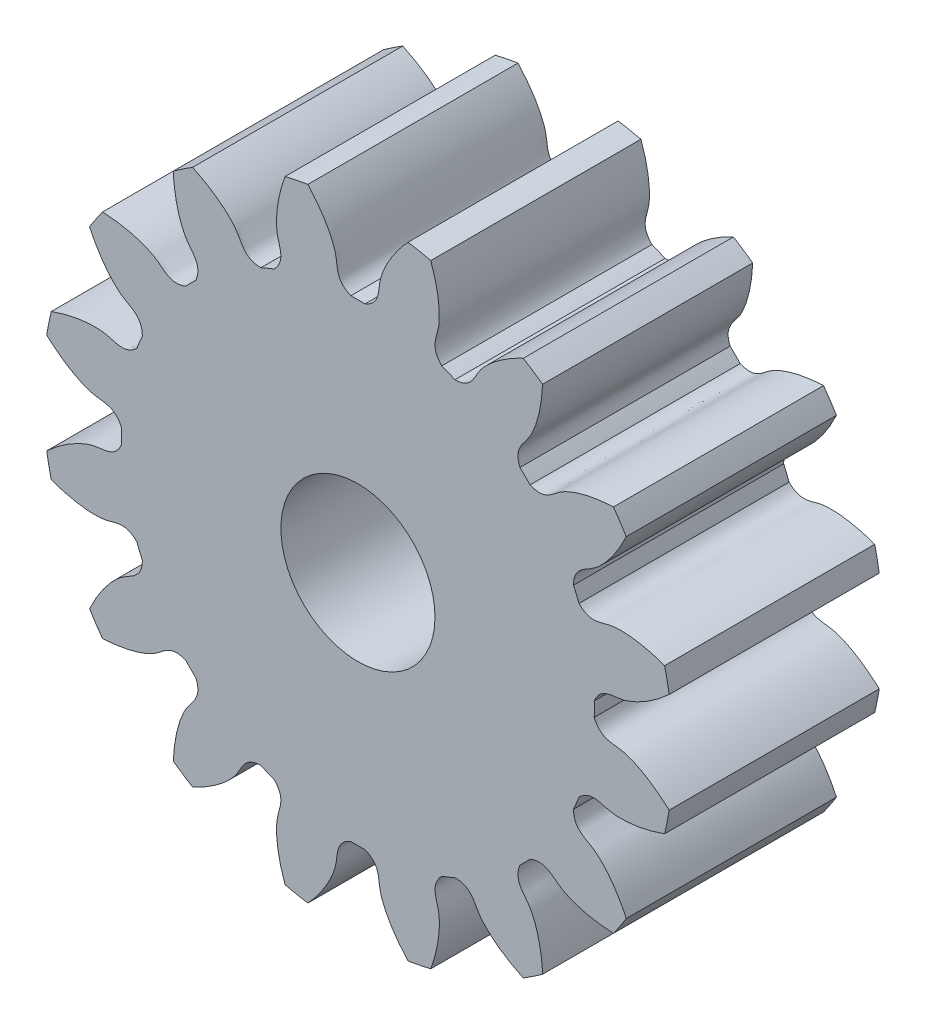
from build123d import *

# Parameters (mm, degrees)
SKETCH_1_R               = 4.5
EXTRUDE_1_DEPTH          = 3
CUT_EXTRUDE_1_DEPTH      = 8.03562364
PATTERN_CIRCULAR_1_COUNT = 16
SKETCH_4_R               = 1.1
CUT_EXTRUDE_2_DEPTH      = 10


with BuildPart() as part:
    # 草图1 → 凸台-拉伸1 (new body)
    with BuildSketch(Plane.XY):
        Circle(SKETCH_1_R)
    extrude(amount=EXTRUDE_1_DEPTH)

    # 草图2 → 切除-拉伸1 (cut, through all)
    with BuildSketch(Plane.XY):
        with BuildLine():
            ThreePointArc((0.101680395, 3.373467963), (0, 3.375), (-0.101680395, 3.373467963))
            add(Edge.make_bspline(
                [(-0.101680395, 3.373467963), (-0.320919735, 3.465061005), (-0.284660598, 3.635349809), (-0.322390644, 3.793404963), (-0.325601394, 3.80577545), (-0.329466049, 3.819526781), (-0.334039479, 3.834637453), (-0.339377888, 3.851083952), (-0.345536205, 3.868841182), (-0.352568839, 3.887882349), (-0.360529384, 3.908179024), (-0.369470654, 3.92970115), (-0.379444617, 3.952417062), (-0.390502356, 3.976293514), (-0.402694025, 4.001295699), (-0.416068812, 4.02738727), (-0.430674889, 4.054530373), (-0.446559381, 4.082685666), (-0.463768319, 4.111812348), (-0.482346604, 4.141868189), (-0.502337967, 4.172809557), (-0.523784931, 4.20459145), (-0.546728776, 4.237167525), (-0.571209498, 4.270490132), (-0.597265778, 4.304510345), (-0.624934946, 4.339177997), (-0.654252942, 4.374441713), (-0.685254293, 4.41024895), (-0.717972069, 4.446546028), (-0.752437861, 4.483278171), (-0.788681746, 4.520389541), (-0.826732258, 4.557823283), (-0.866616358, 4.595521557), (-0.90835941, 4.633425586), (-0.951985152, 4.67147569), (-0.99751567, 4.709611333), (-1.044971373, 4.747771162), (-1.094370973, 4.785893051), (-1.145731456, 4.823914147), (-1.199068069, 4.861770908), (-1.254394289, 4.899399156), (-1.311721817, 4.936734114), (-1.371060539, 4.97371046), (-1.453732402, 5.022959339), (-1.517494148, 5.058370721), (-1.560889991, 5.081371225)],
                knots=[0, 0, 0, 0, 0.200958108, 0.205848205, 0.211390316, 0.217584439, 0.224430575, 0.231928724, 0.240078886, 0.248881062, 0.25833525, 0.268441451, 0.279199665, 0.290609892, 0.302672132, 0.315386384, 0.32875265, 0.342770929, 0.357441221, 0.372763526, 0.388737843, 0.405364174, 0.422642518, 0.440572874, 0.459155244, 0.478389626, 0.498276022, 0.51881443, 0.540004852, 0.561847286, 0.584341734, 0.607488194, 0.631286667, 0.655737153, 0.680839653, 0.706594165, 0.73300069, 0.760059228, 0.787769779, 0.816132343, 0.84514692, 0.87481351, 0.905132113, 0.936102729, 1, 1, 1, 1], degree=3))
            ThreePointArc((-1.560889991, 5.081371225), (0, 5.315704195), (1.560889991, 5.081371225))
            add(Edge.make_bspline(
                [(0.101680395, 3.373467963), (0.320919735, 3.465061005), (0.284660598, 3.635349809), (0.322390644, 3.793404963), (0.325601394, 3.80577545), (0.329466049, 3.819526781), (0.334039479, 3.834637453), (0.339377888, 3.851083952), (0.345536205, 3.868841182), (0.352568839, 3.887882349), (0.360529384, 3.908179024), (0.369470654, 3.92970115), (0.379444617, 3.952417062), (0.390502356, 3.976293514), (0.402694025, 4.001295699), (0.416068812, 4.02738727), (0.430674889, 4.054530373), (0.446559381, 4.082685666), (0.463768319, 4.111812348), (0.482346604, 4.141868189), (0.502337967, 4.172809557), (0.523784931, 4.20459145), (0.546728776, 4.237167525), (0.571209498, 4.270490132), (0.597265778, 4.304510345), (0.624934946, 4.339177997), (0.654252942, 4.374441713), (0.685254293, 4.41024895), (0.717972069, 4.446546028), (0.752437861, 4.483278171), (0.788681746, 4.520389541), (0.826732258, 4.557823283), (0.866616358, 4.595521557), (0.90835941, 4.633425586), (0.951985152, 4.67147569), (0.99751567, 4.709611333), (1.044971373, 4.747771162), (1.094370973, 4.785893051), (1.145731456, 4.823914147), (1.199068069, 4.861770908), (1.254394289, 4.899399156), (1.311721817, 4.936734114), (1.371060539, 4.97371046), (1.453732402, 5.022959339), (1.517494148, 5.058370721), (1.560889991, 5.081371225)],
                knots=[0, 0, 0, 0, 0.200958108, 0.205848205, 0.211390316, 0.217584439, 0.224430575, 0.231928724, 0.240078886, 0.248881062, 0.25833525, 0.268441451, 0.279199665, 0.290609892, 0.302672132, 0.315386384, 0.32875265, 0.342770929, 0.357441221, 0.372763526, 0.388737843, 0.405364174, 0.422642518, 0.440572874, 0.459155244, 0.478389626, 0.498276022, 0.51881443, 0.540004852, 0.561847286, 0.584341734, 0.607488194, 0.631286667, 0.655737153, 0.680839653, 0.706594165, 0.73300069, 0.760059228, 0.787769779, 0.816132343, 0.84514692, 0.87481351, 0.905132113, 0.936102729, 1, 1, 1, 1], degree=3))
        make_face()
    cut_extrude_1 = extrude(amount=CUT_EXTRUDE_1_DEPTH, mode=Mode.SUBTRACT)

    # 阵列(圆周)1: 切除-拉伸1 ×16 about axis
    pattern_circular_1_axis = Axis((0, 0, 3), (0, 0, -1))
    for i in range(1, PATTERN_CIRCULAR_1_COUNT):
        add(cut_extrude_1.rotate(pattern_circular_1_axis, i * 360 / PATTERN_CIRCULAR_1_COUNT), mode=Mode.SUBTRACT)

    # 草图4 → 切除-拉伸2 (cut)
    with BuildSketch(Plane.XY.offset(3)):
        Circle(SKETCH_4_R)
    extrude(amount=-CUT_EXTRUDE_2_DEPTH, mode=Mode.SUBTRACT)


solid = part.part
